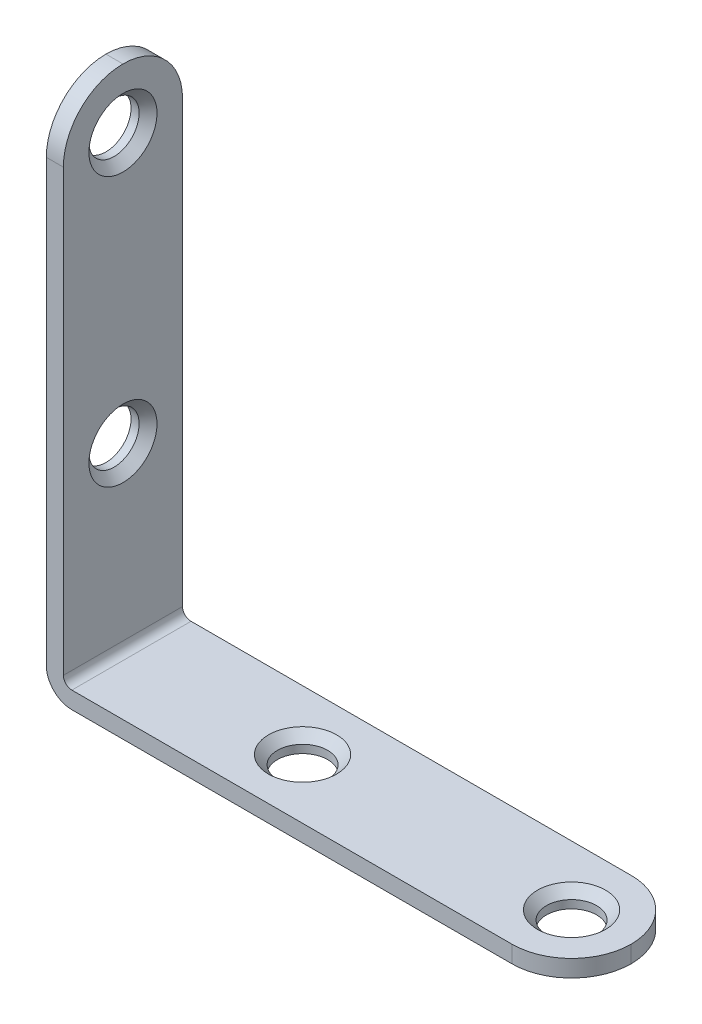
from build123d import *

# Parameters (mm, degrees)
BOSS_EXTRU_1_DEPTH                         = 7
CONG_1_R                                   = 7
FRAISAGE_POUR_VIS_T_TE_FRAIS_E_6_2_COUNT   = 2
FRAISAGE_POUR_VIS_T_TE_FRAIS_E_6_2_PITCH   = 31.6
FRAISAGE_POUR_VIS_T_TE_FRAIS_E_6_3_A_COUNT = 2
FRAISAGE_POUR_VIS_T_TE_FRAIS_E_6_3_A_PITCH = 31.6


with BuildPart() as part:
    # Esquisse1 → Boss.-Extru.1 (new, symmetric)
    with BuildSketch(Plane.XY):
        with BuildLine():
            Line((0, 3), (0, 61.7))
            Line((0, 61.7), (2, 61.7))
            Line((2, 61.7), (2, 3))
            ThreePointArc((2, 3), (2.292893219, 2.292893219), (3, 2))
            Line((3, 2), (61.7, 2))
            Line((61.7, 2), (61.7, 0))
            Line((61.7, 0), (3, 0))
            ThreePointArc((3, 0), (0.878679656, 0.878679656), (0, 3))
        make_face()
    extrude(amount=BOSS_EXTRU_1_DEPTH, both=True)

    # Congé1
    cong_1_edges = [part.edges().sort_by_distance(p)[0] for p in [
        (1, 61.7, -7),
        (1, 61.7, 7),
        (61.7, 1, -7),
        (61.7, 1, 7),
    ]]
    fillet(cong_1_edges, radius=CONG_1_R - 0.0001)  # a hair under: the kernel refuses the full size

    # Esquisse2 → Fraisage pour vis _ t_te frais_e _ 6 pan (revolve, cut)
    with BuildSketch(Plane(origin=(54.7, 2, 0), x_dir=(0, 0, 1), z_dir=(1, 0, 0))):
        Polygon((0, 0), (0, 2), (2.95, 2), (2.95, 1.05), (4, 0), align=None)
    fraisage_pour_vis_t_te_frais_e_6_pan = revolve(axis=Axis((54.7, 8.35, 0), (0, -1, 0)), mode=Mode.SUBTRACT)

    # Fraisage pour vis _ t_te frais_e _ 6 2: Fraisage pour vis _ t_te frais_e _ 6 pan ×2
    with Locations(*[(-i * FRAISAGE_POUR_VIS_T_TE_FRAIS_E_6_2_PITCH, 0, 0) for i in range(1, FRAISAGE_POUR_VIS_T_TE_FRAIS_E_6_2_COUNT)]):
        add(fraisage_pour_vis_t_te_frais_e_6_pan, mode=Mode.SUBTRACT)

    # Esquisse4 → Fraisage pour vis _ t_te frais_e _ 6 3 (revolve, cut)
    with BuildSketch(Plane(origin=(2, 54.7, 0), x_dir=(0, 0, -1), z_dir=(0, 1, 0))):
        Polygon((0, 0), (0, 2), (2.95, 2), (2.95, 1.05), (4, 0), align=None)
    fraisage_pour_vis_t_te_frais_e_6_3 = revolve(axis=Axis((8.35, 54.7, 0), (-1, 0, 0)), mode=Mode.SUBTRACT)

    # Fraisage pour vis _ t_te frais_e _ 6 3 a: Fraisage pour vis _ t_te frais_e _ 6 3 ×2
    with Locations(*[(0, -i * FRAISAGE_POUR_VIS_T_TE_FRAIS_E_6_3_A_PITCH, 0) for i in range(1, FRAISAGE_POUR_VIS_T_TE_FRAIS_E_6_3_A_COUNT)]):
        add(fraisage_pour_vis_t_te_frais_e_6_3, mode=Mode.SUBTRACT)


solid = part.part
